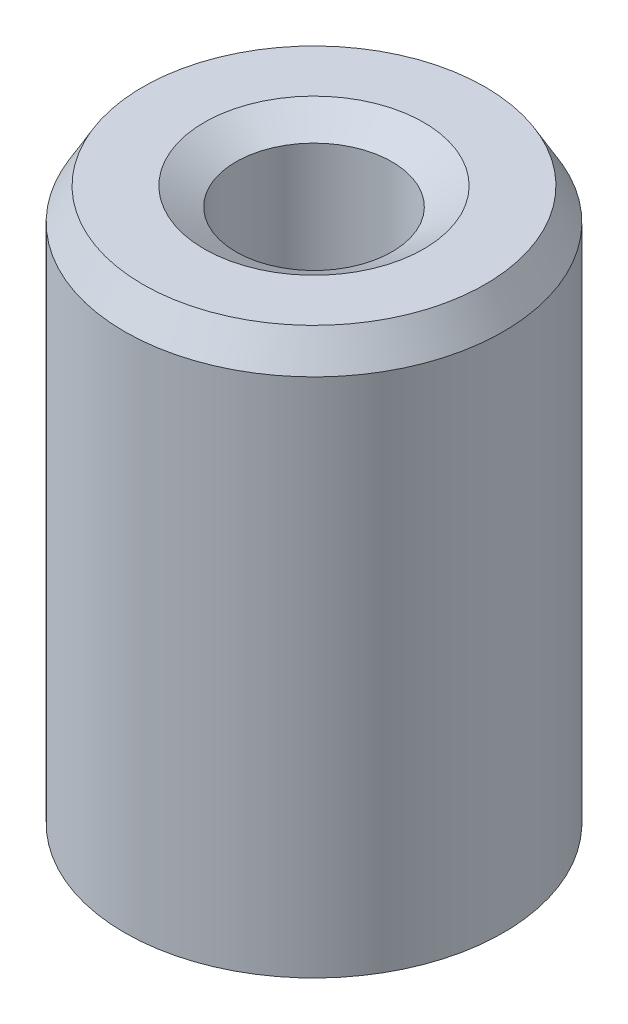
from build123d import *
from OCP.BRepFilletAPI import BRepFilletAPI_MakeChamfer

# Parameters (mm, degrees)
SKETCH1_R           = 20
BOSS_EXTRUDE1_DEPTH = 60.245955612
SKETCH2_R           = 8.239842261
CUT_EXTRUDE1_DEPTH  = 67.55505366
CHAMFER1_SIZE       = 3.346673462
CHAMFER1_SIZE2      = 1.932202824


with BuildPart() as part:
    # Sketch1 → Boss-Extrude1 (new body)
    with BuildSketch(Plane(origin=(0, 0, 0), x_dir=(1, 0, 0), z_dir=(0, 1, 0))):
        Circle(SKETCH1_R)
    extrude(amount=BOSS_EXTRUDE1_DEPTH)

    # Sketch2 → Cut-Extrude1 (cut, through all)
    with BuildSketch(Plane(origin=(0, 0, 0), x_dir=(1, 0, 0), z_dir=(0, 1, 0))):
        Circle(SKETCH2_R)
    extrude(amount=CUT_EXTRUDE1_DEPTH, mode=Mode.SUBTRACT)

    # Chamfer1: one chamfer whose edges measure the first distance from different faces: ONE call of the kernel's chamfer builder (chamfer() names one face for all edges)
    chamfer1_edges_1 = [part.edges().sort_by_distance(p)[0] for p in [
        (-8.239842261, 60.245955612, 0),
    ]]
    chamfer1_side_1 = [part.faces().sort_by_distance(p)[0] for p in [
        (-19.434314575, 60.245955612, 0),
    ]]
    chamfer1_edges_2 = [part.edges().sort_by_distance(p)[0] for p in [
        (-8.239842261, 0, 0),
    ]]
    chamfer1_side_2 = [part.faces().sort_by_distance(p)[0] for p in [
        (-8.239842261, 30.122977806, 0),
    ]]
    chamfer1_edges_3 = [part.edges().sort_by_distance(p)[0] for p in [
        (-20, 0, 0),
    ]]
    chamfer1_side_3 = [part.faces().sort_by_distance(p)[0] for p in [
        (-19.434314575, 0, 0),
    ]]
    chamfer1_edges_4 = [part.edges().sort_by_distance(p)[0] for p in [
        (-20, 60.245955612, 0),
    ]]
    chamfer1_side_4 = [part.faces().sort_by_distance(p)[0] for p in [
        (-20, 30.122977806, 0),
    ]]
    chamfer1 = BRepFilletAPI_MakeChamfer(part.part.solid().wrapped)
    for e in chamfer1_edges_1:
        chamfer1.Add(CHAMFER1_SIZE, CHAMFER1_SIZE2, e.wrapped, chamfer1_side_1[0].wrapped)  # the first distance lies on this face
    for e in chamfer1_edges_2:
        chamfer1.Add(CHAMFER1_SIZE, CHAMFER1_SIZE2, e.wrapped, chamfer1_side_2[0].wrapped)  # the first distance lies on this face
    for e in chamfer1_edges_3:
        chamfer1.Add(CHAMFER1_SIZE, CHAMFER1_SIZE2, e.wrapped, chamfer1_side_3[0].wrapped)  # the first distance lies on this face
    for e in chamfer1_edges_4:
        chamfer1.Add(CHAMFER1_SIZE, CHAMFER1_SIZE2, e.wrapped, chamfer1_side_4[0].wrapped)  # the first distance lies on this face
    add(Compound.cast(chamfer1.Shape()), mode=Mode.REPLACE)


solid = part.part
